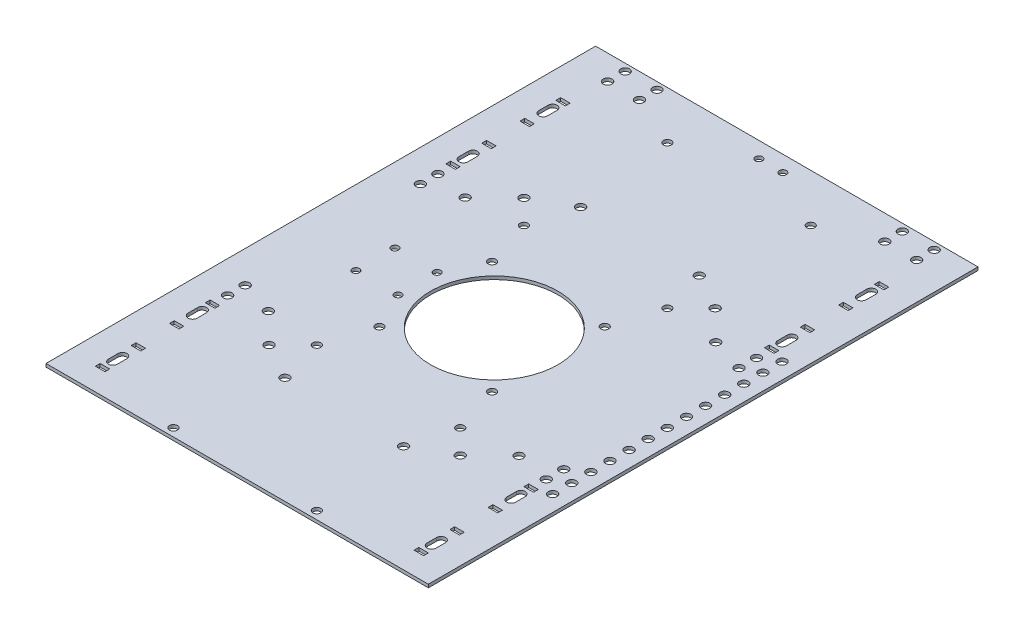
from build123d import *

# Parameters (mm, degrees)
SM_BASE_FLANGE_1_DEPTH   = 2
SKETCH_6_R               = 2.75
CUT_EXTRUDE_1_DEPTH      = 10
SKETCH_7_R               = 2.5
SKETCH_7_R_2             = 40
CUT_EXTRUDE_2_DEPTH      = 10
SKETCH_9_W               = 240
SKETCH_9_H               = 20
EXTRUDE_1_DEPTH          = 2
SKETCH_8_R               = 2.75
SKETCH_8_W               = 6
SKETCH_8_H               = 3
CUT_EXTRUDE_3_DEPTH      = 10
MIRROR_2_COPY_1_SKETCH_R = 2.75
MIRROR_2_COPY_1_SKETCH_W = 6
MIRROR_2_COPY_1_SKETCH_H = 3
MIRROR_2_COPY_1_DEPTH    = 10
SKETCH_10_R              = 2.75
CUT_EXTRUDE_4_DEPTH      = 10
SKETCH_11_R              = 2.75
CUT_EXTRUDE_5_DEPTH      = 10
SKETCH_12_R              = 2.25
CUT_EXTRUDE_6_DEPTH      = 10
SKETCH_13_R              = 2.5
CUT_EXTRUDE_7_DEPTH      = 3


# Sheet-metal steps are written as plain solids
with BuildPart() as part:
    # Sketch 1 → 基体-法兰1 (new body)
    with BuildSketch(Plane(origin=(0, 0, 0), x_dir=(1, 0, 0), z_dir=(0, 1, 0))):
        Polygon((-120, 140), (-120, -140), (120, -140), (120, 140), (120, 185), (-120, 185), align=None)
    extrude(amount=-SM_BASE_FLANGE_1_DEPTH)

    # 草图6 → 切除-拉伸1 (cut)
    with BuildSketch(Plane(origin=(0, 0, 0), x_dir=(1, 0, 0), z_dir=(0, 1, 0))):
        with Locations(Location((-60, -80, 0), (0, 0, 270))):
            Circle(SKETCH_6_R)
        with Locations(Location((-78.661073186, -61.744923397, 0), (0, 0, 270))):
            Circle(SKETCH_6_R)
        with Locations(Location((-37.250025969, -92.803208809, 0), (0, 0, 270))):
            Circle(SKETCH_6_R)
        with Locations(Location((37.250025969, -92.803208809, 0), (0, 0, 270))):
            Circle(SKETCH_6_R)
        with Locations(Location((78.661073186, -61.744923397, 0), (0, 0, 270))):
            Circle(SKETCH_6_R)
        with Locations(Location((60, -80, 0), (0, 0, 270))):
            Circle(SKETCH_6_R)
        with Locations(Location((78.661073186, 61.744923397, 0), (0, 0, 270))):
            Circle(SKETCH_6_R)
        with Locations(Location((37.250025969, 92.803208809, 0), (0, 0, 270))):
            Circle(SKETCH_6_R)
        with Locations(Location((-60, 80, 0), (0, 0, 270))):
            Circle(SKETCH_6_R)
        with Locations(Location((60, 80, 0), (0, 0, 270))):
            Circle(SKETCH_6_R)
        with Locations(Location((-78.661073186, 61.744923397, 0), (0, 0, 270))):
            Circle(SKETCH_6_R)
        with Locations(Location((-37.250025969, 92.803208809, 0), (0, 0, 270))):
            Circle(SKETCH_6_R)
    extrude(amount=-CUT_EXTRUDE_1_DEPTH, mode=Mode.SUBTRACT)

    # 草图7 → 切除-拉伸2 (cut)
    with BuildSketch(Plane(origin=(0, 0, 0), x_dir=(1, 0, 0), z_dir=(0, 1, 0))):
        with Locations(Location((-35.355339059, 35.355339059, 0), (0, 0, 270))):
            Circle(SKETCH_7_R)
        with Locations(Location((35.355339059, 35.355339059, 0), (0, 0, 270))):
            Circle(SKETCH_7_R)
        with Locations(Location((35.355339059, -35.355339059, 0), (0, 0, 270))):
            Circle(SKETCH_7_R)
        with Locations(Location((-35.355339059, -35.355339059, 0), (0, 0, 270))):
            Circle(SKETCH_7_R)
        with Locations(Location((1.384475496, 0, 0), (0, 0, 270))):
            Circle(SKETCH_7_R_2)
    extrude(amount=-CUT_EXTRUDE_2_DEPTH, mode=Mode.SUBTRACT)

    # 草图9 → 凸台-拉伸1 (add)
    with BuildSketch(Plane(origin=(0, 0, 0), x_dir=(1, 0, 0), z_dir=(0, 1, 0))):
        with Locations((0, -150)):
            Rectangle(SKETCH_9_W, SKETCH_9_H)
    extrude(amount=-EXTRUDE_1_DEPTH)

    # 草图8 → 切除-拉伸3 (cut)
    with BuildSketch(Plane(origin=(0, 0, 0), x_dir=(1, 0, 0), z_dir=(0, 1, 0))):
        with Locations(Location((100, -66, 0), (0, 0, 270))):
            Circle(SKETCH_8_R)
        with Locations(Location((100, -55, 0), (0, 0, 270))):
            Circle(SKETCH_8_R)
        with BuildLine():
            Line((102.8, -132), (102.8, -138))
            ThreePointArc((102.8, -138), (100, -140.8), (97.2, -138))
            Line((97.2, -138), (97.2, -132))
            ThreePointArc((97.2, -132), (100, -129.2), (102.8, -132))
        make_face()
        with Locations((100, -144.5)):
            Rectangle(SKETCH_8_W, SKETCH_8_H)
        with Locations((100, -122)):
            Rectangle(SKETCH_8_W, SKETCH_8_H)
        with Locations((100, -98)):
            Rectangle(SKETCH_8_W, SKETCH_8_H)
        with Locations((100, -75.5)):
            Rectangle(SKETCH_8_W, SKETCH_8_H)
        with BuildLine():
            Line((102.8, -88), (102.8, -82))
            ThreePointArc((102.8, -82), (100, -79.2), (97.2, -82))
            Line((97.2, -82), (97.2, -88))
            ThreePointArc((97.2, -88), (100, -90.8), (102.8, -88))
        make_face()
    cut_extrude_3 = extrude(amount=-CUT_EXTRUDE_3_DEPTH, mode=Mode.SUBTRACT)

    # 镜向1: 切除-拉伸3 across plane
    add(cut_extrude_3.mirror(Plane.XY), mode=Mode.SUBTRACT)

    # 镜向2: 切除-拉伸3 across plane
    add(cut_extrude_3.mirror(Plane(origin=(0, 0, 0), x_dir=(0, 0, 1), z_dir=(1, 0, 0))), mode=Mode.SUBTRACT)

    # 镜向2 copy 1 sketch → 镜向2 copy 1 (cut)
    with BuildSketch(Plane(origin=(0, 0, 0), x_dir=(-1, 0, 0), z_dir=(0, 1, 0))):
        with Locations(Location((100, -66, 0), (0, 0, 270))):
            Circle(MIRROR_2_COPY_1_SKETCH_R)
        with Locations(Location((100, -55, 0), (0, 0, 270))):
            Circle(MIRROR_2_COPY_1_SKETCH_R)
        with BuildLine():
            Line((102.8, -132), (102.8, -138))
            ThreePointArc((102.8, -138), (100, -140.8), (97.2, -138))
            Line((97.2, -138), (97.2, -132))
            ThreePointArc((97.2, -132), (100, -129.2), (102.8, -132))
        make_face()
        with Locations((100, -144.5)):
            Rectangle(MIRROR_2_COPY_1_SKETCH_W, MIRROR_2_COPY_1_SKETCH_H)
        with Locations((100, -122)):
            Rectangle(MIRROR_2_COPY_1_SKETCH_W, MIRROR_2_COPY_1_SKETCH_H)
        with Locations((100, -98)):
            Rectangle(MIRROR_2_COPY_1_SKETCH_W, MIRROR_2_COPY_1_SKETCH_H)
        with Locations((100, -75.5)):
            Rectangle(MIRROR_2_COPY_1_SKETCH_W, MIRROR_2_COPY_1_SKETCH_H)
        with BuildLine():
            Line((102.8, -88), (102.8, -82))
            ThreePointArc((102.8, -82), (100, -79.2), (97.2, -82))
            Line((97.2, -82), (97.2, -88))
            ThreePointArc((97.2, -88), (100, -90.8), (102.8, -88))
        make_face()
    extrude(amount=-MIRROR_2_COPY_1_DEPTH, mode=Mode.SUBTRACT)

    # 草图10 → 切除-拉伸4 (cut)
    with BuildSketch(Plane(origin=(0, 0, 0), x_dir=(1, 0, 0), z_dir=(0, 1, 0))):
        with Locations(Location((-97, 180.5, 0), (0, 0, 270))):
            Circle(SKETCH_10_R)
        with Locations(Location((-77, 180.5, 0), (0, 0, 270))):
            Circle(SKETCH_10_R)
        with Locations(Location((-97, 169.5, 0), (0, 0, 270))):
            Circle(SKETCH_10_R)
        with Locations(Location((-77, 169.5, 0), (0, 0, 270))):
            Circle(SKETCH_10_R)
    cut_extrude_4 = extrude(amount=-CUT_EXTRUDE_4_DEPTH, mode=Mode.SUBTRACT)

    # 镜向3: 切除-拉伸4 across plane
    add(cut_extrude_4.mirror(Plane(origin=(0, 0, 0), x_dir=(0, 0, 1), z_dir=(1, 0, 0))), mode=Mode.SUBTRACT)

    # 草图11 → 切除-拉伸5 (cut)
    with BuildSketch(Plane(origin=(0, 0, 0), x_dir=(1, 0, 0), z_dir=(0, 1, 0))):
        with Locations(Location((110, 72, 0), (0, 0, 270))):
            Circle(SKETCH_11_R)
        with Locations(Location((110, 60, 0), (0, 0, 270))):
            Circle(SKETCH_11_R)
        with Locations(Location((110, 48, 0), (0, 0, 270))):
            Circle(SKETCH_11_R)
        with Locations(Location((110, 36, 0), (0, 0, 270))):
            Circle(SKETCH_11_R)
        with Locations(Location((110, 24, 0), (0, 0, 270))):
            Circle(SKETCH_11_R)
        with Locations(Location((110, 12, 0), (0, 0, 270))):
            Circle(SKETCH_11_R)
        with Locations(Location((110, 0, 0), (0, 0, 270))):
            Circle(SKETCH_11_R)
        with Locations(Location((110, -12, 0), (0, 0, 270))):
            Circle(SKETCH_11_R)
        with Locations(Location((110, -24, 0), (0, 0, 270))):
            Circle(SKETCH_11_R)
        with Locations(Location((110, -36, 0), (0, 0, 270))):
            Circle(SKETCH_11_R)
        with Locations(Location((110, -48, 0), (0, 0, 270))):
            Circle(SKETCH_11_R)
        with Locations(Location((110, -60, 0), (0, 0, 270))):
            Circle(SKETCH_11_R)
        with Locations(Location((110, -72, 0), (0, 0, 270))):
            Circle(SKETCH_11_R)
    extrude(amount=-CUT_EXTRUDE_5_DEPTH, mode=Mode.SUBTRACT)

    # 草图12 → 切除-拉伸6 (cut)
    with BuildSketch(Plane(origin=(0, 0, 0), x_dir=(1, 0, 0), z_dir=(0, 1, 0))):
        with Locations(Location((-73.25, 12.25, 0), (0, 0, 270))):
            Circle(SKETCH_12_R)
        with Locations(Location((-73.25, -12.25, 0), (0, 0, 270))):
            Circle(SKETCH_12_R)
        with Locations(Location((-46.75, 12.25, 0), (0, 0, 270))):
            Circle(SKETCH_12_R)
        with Locations(Location((-46.75, -12.25, 0), (0, 0, 270))):
            Circle(SKETCH_12_R)
        with Locations(Location((7.5, 175, 0), (0, 0, 270))):
            Circle(SKETCH_12_R)
        with Locations(Location((-7.5, 175, 0), (0, 0, 270))):
            Circle(SKETCH_12_R)
    extrude(amount=-CUT_EXTRUDE_6_DEPTH, mode=Mode.SUBTRACT)

    # 草图13 → 切除-拉伸7 (cut)
    with BuildSketch(Plane(origin=(0, 0, 0), x_dir=(1, 0, 0), z_dir=(0, 1, 0))):
        with Locations(Location((-45, 155, 0), (0, 0, 270))):
            Circle(SKETCH_13_R)
        with Locations(Location((-45, 65, 0), (0, 0, 270))):
            Circle(SKETCH_13_R)
        with Locations(Location((45, 65, 0), (0, 0, 270))):
            Circle(SKETCH_13_R)
        with Locations(Location((45, 155, 0), (0, 0, 270))):
            Circle(SKETCH_13_R)
    cut_extrude_7 = extrude(amount=-CUT_EXTRUDE_7_DEPTH, mode=Mode.SUBTRACT)

    # 镜向4: 切除-拉伸7 across plane
    add(cut_extrude_7.mirror(Plane.XY), mode=Mode.SUBTRACT)


solid = part.part
